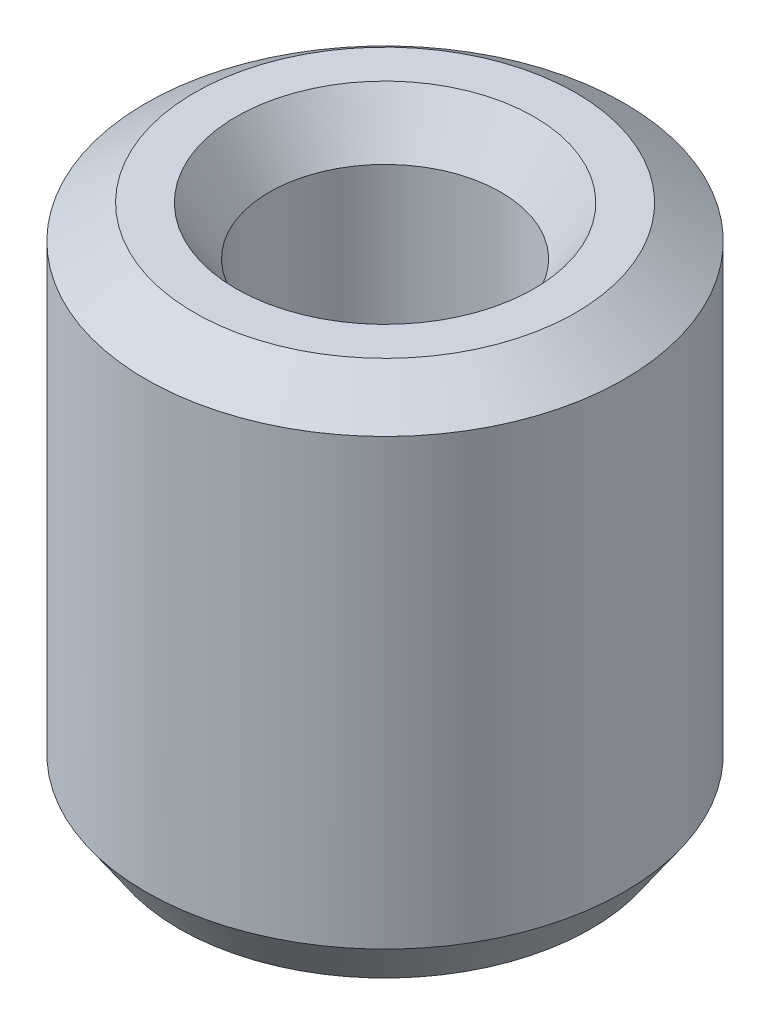
from build123d import *
from OCP.BRepFilletAPI import BRepFilletAPI_MakeChamfer

# Parameters (mm, degrees)
SKETCH1_R           = 10
BOSS_EXTRUDE1_DEPTH = 21.987916303
SKETCH2_R           = 4.837298063
CUT_EXTRUDE1_DEPTH  = 27.14322978
CHAMFER1_SIZE       = 1.392943304
CHAMFER1_SIZE2      = 2.031408278


with BuildPart() as part:
    # Sketch1 → Boss-Extrude1 (new body)
    with BuildSketch(Plane(origin=(0, 0, 0), x_dir=(1, 0, 0), z_dir=(0, 1, 0))):
        Circle(SKETCH1_R)
    extrude(amount=BOSS_EXTRUDE1_DEPTH)

    # Sketch2 → Cut-Extrude1 (cut, through all)
    with BuildSketch(Plane(origin=(0, 0, 0), x_dir=(1, 0, 0), z_dir=(0, 1, 0))):
        Circle(SKETCH2_R)
    extrude(amount=CUT_EXTRUDE1_DEPTH, mode=Mode.SUBTRACT)

    # Chamfer1: one chamfer whose edges measure the first distance from different faces: ONE call of the kernel's chamfer builder (chamfer() names one face for all edges)
    chamfer1_edges_1 = [part.edges().sort_by_distance(p)[0] for p in [
        (-4.837298063, 21.987916303, 0),
    ]]
    chamfer1_side_1 = [part.faces().sort_by_distance(p)[0] for p in [
        (-9.717157288, 21.987916303, 0),
    ]]
    chamfer1_edges_2 = [part.edges().sort_by_distance(p)[0] for p in [
        (-4.837298063, 0, 0),
    ]]
    chamfer1_side_2 = [part.faces().sort_by_distance(p)[0] for p in [
        (-4.837298063, 10.993958151, 0),
    ]]
    chamfer1_edges_3 = [part.edges().sort_by_distance(p)[0] for p in [
        (-10, 0, 0),
    ]]
    chamfer1_side_3 = [part.faces().sort_by_distance(p)[0] for p in [
        (-9.717157288, 0, 0),
    ]]
    chamfer1_edges_4 = [part.edges().sort_by_distance(p)[0] for p in [
        (-10, 21.987916303, 0),
    ]]
    chamfer1_side_4 = [part.faces().sort_by_distance(p)[0] for p in [
        (-10, 10.993958151, 0),
    ]]
    chamfer1 = BRepFilletAPI_MakeChamfer(part.part.solid().wrapped)
    for e in chamfer1_edges_1:
        chamfer1.Add(CHAMFER1_SIZE, CHAMFER1_SIZE2, e.wrapped, chamfer1_side_1[0].wrapped)  # the first distance lies on this face
    for e in chamfer1_edges_2:
        chamfer1.Add(CHAMFER1_SIZE, CHAMFER1_SIZE2, e.wrapped, chamfer1_side_2[0].wrapped)  # the first distance lies on this face
    for e in chamfer1_edges_3:
        chamfer1.Add(CHAMFER1_SIZE, CHAMFER1_SIZE2, e.wrapped, chamfer1_side_3[0].wrapped)  # the first distance lies on this face
    for e in chamfer1_edges_4:
        chamfer1.Add(CHAMFER1_SIZE, CHAMFER1_SIZE2, e.wrapped, chamfer1_side_4[0].wrapped)  # the first distance lies on this face
    add(Compound.cast(chamfer1.Shape()), mode=Mode.REPLACE)


solid = part.part
